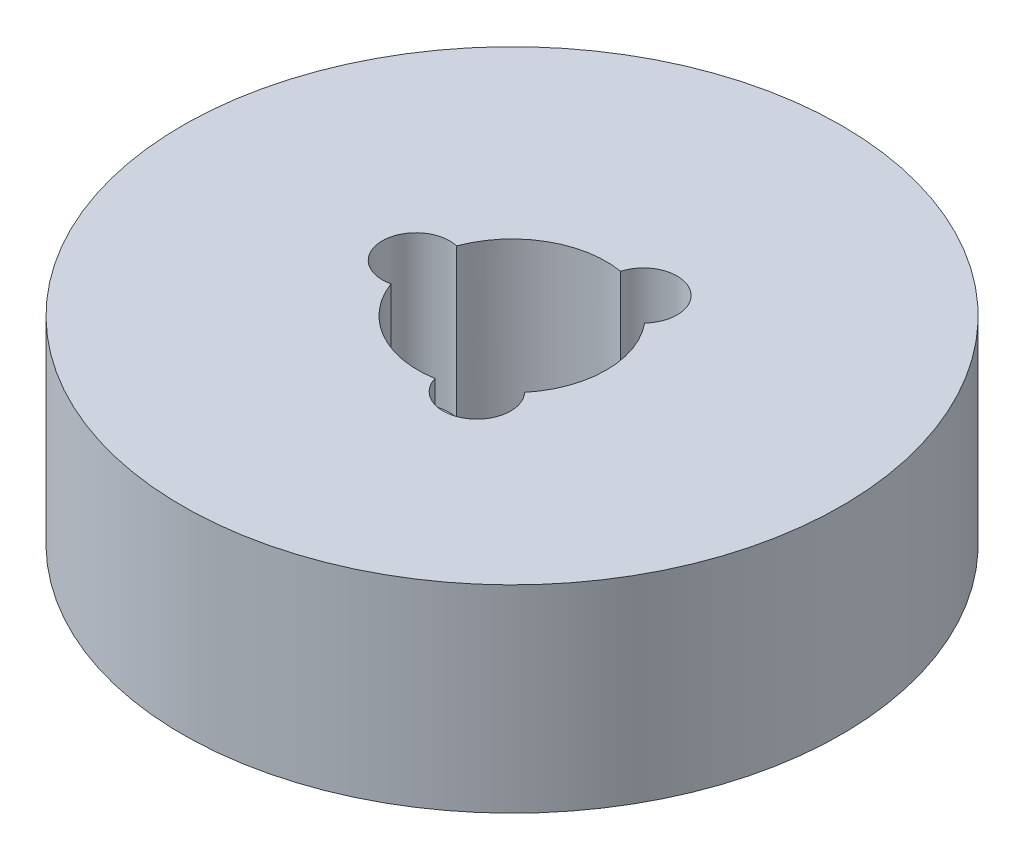
from build123d import *

# Parameters (mm, degrees)
SKETCH1_R           = 35
BOSS_EXTRUDE1_DEPTH = 21
SKETCH2_R           = 10
CUT_EXTRUDE1_DEPTH  = 54.768020235
SKETCH3_R           = 3.586350362
CUT_EXTRUDE2_DEPTH  = 15.797446886
CIRPATTERN1_COUNT   = 3


with BuildPart() as part:
    # Sketch1 → Boss-Extrude1 (new body)
    with BuildSketch(Plane(origin=(0, 0, 0), x_dir=(1, 0, 0), z_dir=(0, 1, 0))):
        Circle(SKETCH1_R)
    extrude(amount=BOSS_EXTRUDE1_DEPTH)

    # Sketch2 → Cut-Extrude1 (cut, through all)
    with BuildSketch(Plane(origin=(0, 0, 0), x_dir=(1, 0, 0), z_dir=(0, 1, 0))):
        Circle(SKETCH2_R)
    extrude(amount=CUT_EXTRUDE1_DEPTH, mode=Mode.SUBTRACT)

    # Sketch3 → Cut-Extrude2 (cut)
    with BuildSketch(Plane(origin=(0, 21, 0), x_dir=(1, 0, 0), z_dir=(0, 1, 0))):
        with Locations((-10.207347194, 0)):
            Circle(SKETCH3_R)
    cut_extrude2 = extrude(amount=-CUT_EXTRUDE2_DEPTH, mode=Mode.SUBTRACT)

    # CirPattern1: Cut-Extrude2 ×3 about axis
    cirpattern1_axis = Axis((0, 0, 0), (0, 1, 0))
    for i in range(1, CIRPATTERN1_COUNT):
        add(cut_extrude2.rotate(cirpattern1_axis, i * 360 / CIRPATTERN1_COUNT), mode=Mode.SUBTRACT)


solid = part.part
